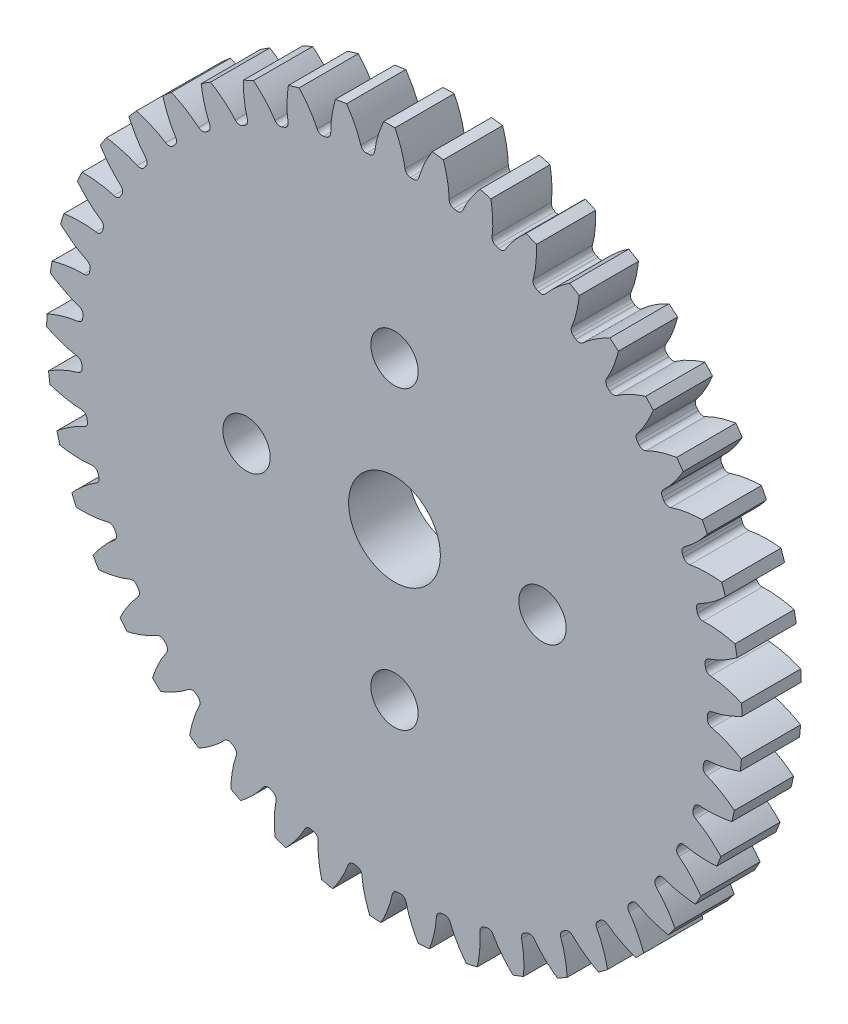
from build123d import *

# Parameters (mm, degrees)
SKETCH_2_R                       = 23.5
EXTRUDE_1_DEPTH                  = 4
CUT_EXTRUDE_START                = -4
CUT_EXTRUDE_1_DEPTH              = 4
FILLET_1_R                       = 0.38
PATTERN_CIRCULAR_1_COUNT         = 45
FILLET_1_OF_PATTERN_CIRCULAR_1_R = 0.38
SKETCH_4_R                       = 1.6
CUT_EXTRUDE_2_DEPTH              = 4
PATTERN_CIRCULAR_2_COUNT         = 4
SKETCH_6_R                       = 3.1
CUT_EXTRUDE_3_DEPTH              = 34.473734959


with BuildPart() as part:
    # 草圖2 → 填料-伸長1 (new body)
    with BuildSketch(Plane.XY):
        Circle(SKETCH_2_R)
    extrude(amount=EXTRUDE_1_DEPTH)

    # 草圖3 → 除料-伸長1 (cut)
    with BuildSketch(Plane.XY.offset(4).offset(CUT_EXTRUDE_START)):
        with BuildLine():
            ThreePointArc((23.43591617, -1.734310607), (23.495202509, -0.474825316), (23.486850826, 0.786026903))
            add(Edge.make_bspline(
                [(21.145, 3.4438e-05), (21.154162208, 0.000211434), (21.180714647, 0.00117603), (21.231283553, 0.004902898), (21.313928182, 0.013742255), (21.419506057, 0.029144733), (21.555451379, 0.053717284), (21.714808328, 0.08864303), (21.888949728, 0.133261928), (22.077177721, 0.188498697), (22.263747746, 0.249495305), (22.448611497, 0.315790429), (22.631562051, 0.386724847), (22.851626933, 0.478388768), (23.088966633, 0.585308958), (23.279319019, 0.678361966), (23.423670257, 0.752736217), (23.486850826, 0.786026903)],
                knots=[0.000267123, 0.000267123, 0.000267123, 0.000267123, 0.000267123, 0.005376749, 0.015083688, 0.02853182, 0.046610139, 0.064854849, 0.092110525, 0.119476176, 0.146842496, 0.174208854, 0.201574956, 0.228941013, 0.256307345, 0.307035032, 0.346884984, 0.346884984, 0.346884984, 0.346884984, 0.346884984], degree=4))
            ThreePointArc((21.145, 3.4438e-05), (21.140683278, -0.427241758), (21.127733485, -0.854343484))
            add(Edge.make_bspline(
                [(21.127733485, -0.854343484), (21.136881061, -0.854890511), (21.163372848, -0.856927102), (21.213749889, -0.862694033), (21.295969906, -0.874865215), (21.400839278, -0.894520718), (21.535680809, -0.924565724), (21.693496558, -0.965901359), (21.865693057, -1.017519558), (22.051535662, -1.080316092), (22.23548894, -1.148800775), (22.417523264, -1.22251071), (22.597458515, -1.300778854), (22.813640268, -1.401259083), (23.046466344, -1.517681069), (23.232903738, -1.618348794), (23.374132213, -1.698494456), (23.43591617, -1.734310607)],
                knots=[0.000267123, 0.000267123, 0.000267123, 0.000267123, 0.000267123, 0.005376749, 0.015083688, 0.02853182, 0.046610139, 0.064854849, 0.092110525, 0.119476176, 0.146842496, 0.174208854, 0.201574956, 0.228941013, 0.256307345, 0.307035032, 0.346884984, 0.346884984, 0.346884984, 0.346884984, 0.346884984], degree=4))
        make_face()
    cut_extrude_1 = extrude(amount=CUT_EXTRUDE_1_DEPTH, mode=Mode.SUBTRACT)

    # 圓角1
    fillet_1_edges = [part.edges().sort_by_distance(p)[0] for p in [
        (21.127733485, -0.854343484, 2),
        (21.145, 3.4438e-05, 2),
    ]]
    fillet(fillet_1_edges, radius=FILLET_1_R)

    # 環狀複製排列1: 除料-伸長1 ×45 about axis
    pattern_circular_1_axis = Axis((0, 0, 4), (0, 0, -1))
    for i in range(1, PATTERN_CIRCULAR_1_COUNT):
        add(cut_extrude_1.rotate(pattern_circular_1_axis, i * 360 / PATTERN_CIRCULAR_1_COUNT), mode=Mode.SUBTRACT)

    # 圓角1 of 環狀複製排列1
    fillet_1_of_pattern_circular_1_edges = [part.edges().sort_by_distance(p)[0] for p in [
        (20.803218203, -3.786441257, 2),
        (20.939223106, -2.942781117, 2),
        (20.073791942, -6.644840259, 2),
        (20.325888053, -5.828318785, 2),
        (18.953652155, -9.373905003, 2),
        (19.316932709, -8.600414857, 2),
        (17.464601088, -11.920517348, 2),
        (17.931995243, -11.205113637, 2),
        (15.635621426, -14.235110383, 2),
        (16.198031886, -13.591717626, 2),
        (13.502312178, -16.272633187, 2),
        (14.148792264, -15.713774291, 2),
        (11.106195783, -17.993427695, 2),
        (11.824162494, -17.529980214, 2),
        (8.49390992, -19.364000601, 2),
        (9.269388852, -19.004985012, 2),
        (5.716299762, -20.357675261, 2),
        (6.534197099, -20.110079395, 2),
        (2.827428331, -20.955110929, 2),
        (3.671824632, -20.823753957, 2),
        (-0.116475776, -21.144679198, 2),
        (0.737984275, -21.132117835, 2),
        (-3.058112815, -20.922690339, 2),
        (-2.210220106, -21.029169077, 2),
        (-5.940227166, -20.293465111, 2),
        (-5.115405067, -20.516911463, 2),
        (-8.706721752, -19.269250669, 2),
        (-7.921024487, -19.605315505, 2),
        (-11.303749903, -17.86998218, 2),
        (-10.572470176, -18.312124382, 2),
        (-13.68076342, -16.122894816, 2),
        (-13.018134758, -16.662508587, 2),
        (-15.791496439, -14.061993643, 2),
        (-15.210416155, -14.688576016, 2),
        (-17.594865942, -11.727391759, 2),
        (-17.106644104, -12.428747021, 2),
        (-19.055771394, -9.164529535, 2),
        (-18.669910683, -9.927006602, 2),
        (-20.145777931, -6.423290167, 2),
        (-19.869788688, -7.232048292, 2),
        (-20.843669816, -3.557028763, 2),
        (-20.682923857, -4.396326388, 2),
        (-21.135863377, -0.62153384, 2),
        (-21.09348944, -1.475034991, 2),
        (-21.016671399, 2.326058532, 2),
        (-21.093494245, 1.474966283, 2),
        (-20.488413819, 5.228376821, 2),
        (-20.682938178, 4.396259017, 2),
        (-19.561372569, 8.028930702, 2),
        (-19.869812245, 7.231983569, 2),
        (-18.253591452, 10.67321058, 2),
        (-18.669943019, 9.926945788, 2),
        (-16.590524942, 13.109748555, 2),
        (-17.106684588, 12.428691299, 2),
        (-14.604542734, 15.291120185, 2),
        (-15.210464001, 14.688526471, 2),
        (-12.334299715, 17.174867555, 2),
        (-13.018189033, 16.662466183, 2),
        (-9.823983582, 18.724325664, 2),
        (-10.572529824, 18.312089944, 2),
        (-7.122454783, 19.909336073, 2),
        (-7.921088348, 19.605289704, 2),
        (-4.282295503, 20.706833902, 2),
        (-5.115471898, 20.516894801, 2),
        (-1.358786212, 21.101296762, 2),
        (-2.210288605, 21.029161878, 2),
        (1.591170306, 21.085046883, 2),
        (0.737915441, 21.132120239, 2),
        (4.510156505, 20.65840055, 2),
        (3.671756802, 20.823765918, 2),
        (7.341357637, 19.82966195, 2),
        (6.534131594, 20.110100679, 2),
        (10.029667594, 18.614961535, 2),
        (9.269326946, 19.005015206, 2),
        (12.522761479, 17.037942069, 2),
        (11.824105393, 17.530018729, 2),
        (14.772114057, 15.12929844, 2),
        (14.148741079, 15.713820378, 2),
        (16.733944238, 12.926180226, 2),
        (16.197987613, 13.591770388, 2),
        (18.370067229, 10.471468618, 2),
        (17.931958744, 11.205172047, 2),
        (19.648637756, 7.812941784, 2),
        (19.316904695, 8.600477779, 2),
        (20.5447699, 5.002344926, 2),
        (20.325869068, 5.828384993, 2),
        (21.041021467, 2.094383113, 2),
        (20.939213521, 2.942849323, 2),
    ]]
    fillet(fillet_1_of_pattern_circular_1_edges, radius=FILLET_1_OF_PATTERN_CIRCULAR_1_R)

    # 草圖4 → 除料-伸長2 (cut)
    with BuildSketch(Plane.XY.offset(4)):
        with Locations((10, 0)):
            Circle(SKETCH_4_R)
    cut_extrude_2 = extrude(amount=-CUT_EXTRUDE_2_DEPTH, mode=Mode.SUBTRACT)

    # 環狀複製排列2: 除料-伸長2 ×4 about axis
    pattern_circular_2_axis = Axis((0, 0, 4), (0, 0, -1))
    for i in range(1, PATTERN_CIRCULAR_2_COUNT):
        add(cut_extrude_2.rotate(pattern_circular_2_axis, i * 360 / PATTERN_CIRCULAR_2_COUNT), mode=Mode.SUBTRACT)

    # 草圖6 → 除料-伸長3 (cut, through all)
    with BuildSketch(Plane.XY.offset(4)):
        Circle(SKETCH_6_R)
    extrude(amount=-CUT_EXTRUDE_3_DEPTH, mode=Mode.SUBTRACT)


solid = part.part
